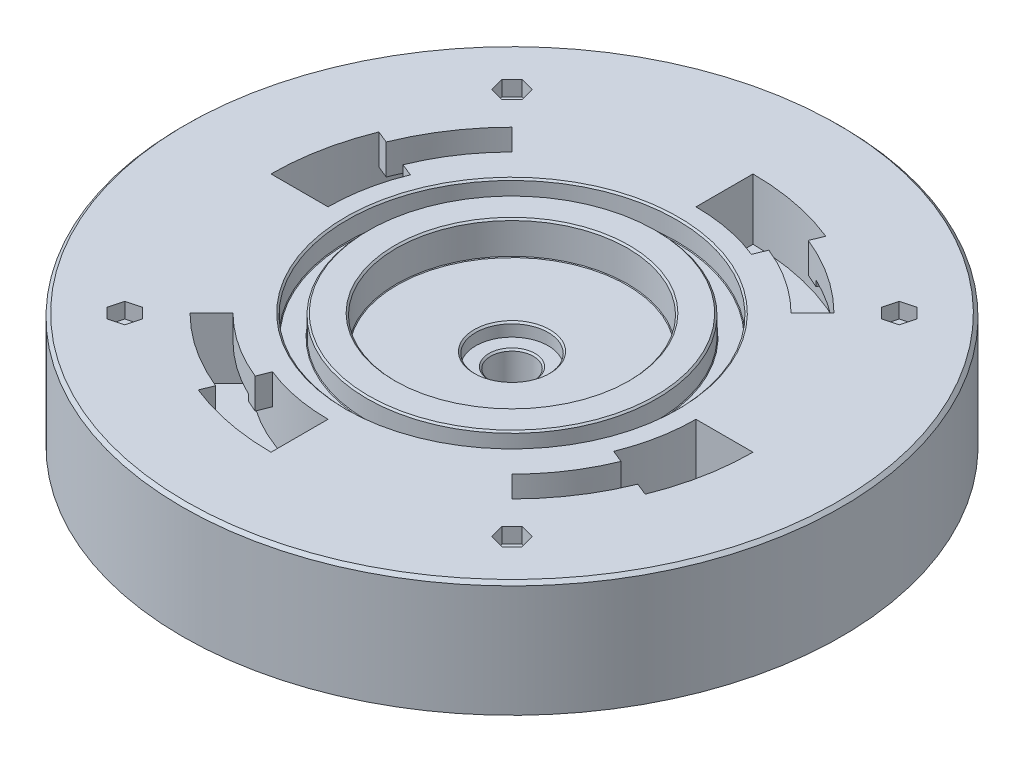
from build123d import *

# Parameters (mm, degrees)
SKETCH2_R                 = 50
BOSS_EXTRUDE1_DEPTH       = 10
SKETCH8_R                 = 17.55
CUT_EXTRUDE4_DEPTH        = 5.05
SKETCH12_R                = 3.25
CUT_EXTRUDE7_DEPTH        = 71.890778667
SKETCH13_R                = 5.5
CUT_EXTRUDE8_DEPTH        = 2
SKETCH14_R                = 15
SKETCH14_R_2              = 3.25
BOSS_EXTRUDE3_DEPTH       = 7.5
CHAMFER1_SIZE             = 7.5
SKETCH15_R                = 5.1
CUT_EXTRUDE9_DEPTH        = 2.5
CHAFL_N2_SIZE             = 0.5
SKETCH16_R                = 25
SKETCH16_R_2              = 22
CUT_EXTRUDE10_DEPTH       = 3.2
CHAMFER2_SIZE             = 0.1
CHAMFER3_SIZE             = 0.25
CHAMFER5_SIZE             = 0.25
SCALE1_SCALE              = 2.1714285
BOSS_EXTRUDE4_START       = -17.3714281
BOSS_EXTRUDE4_OUTLINE_R   = 108.571425
BOSS_EXTRUDE4_OUTLINE_R_2 = 57.926200599
BOSS_EXTRUDE4_DEPTH       = 17.3714281
BOSS_EXTRUDE5_START       = -5
SKETCH17_3_R              = 100.830783289
SKETCH17_3_R_2            = 57.926200599
BOSS_EXTRUDE5_DEPTH       = 5
CUT_EXTRUDE11_DEPTH       = 5.05
CIRPATTERN1_COUNT         = 4
CUT_EXTRUDE12_START       = -13
CUT_EXTRUDE12_DEPTH       = 29
BOSS_EXTRUDE6_START       = -8
BOSS_EXTRUDE6_DEPTH       = 8
CUT_EXTRUDE13_DEPTH       = 20
BOSS_EXTRUDE7_START       = 2
BOSS_EXTRUDE7_DEPTH       = 2
CIRPATTERN2_COUNT         = 4
CIRPATTERN3_COUNT         = 4


# Read off the part's stored shape, not the designer's step: Boss-Extrude4
with BuildPart() as part:
    # Sketch2 → Boss-Extrude1 (new body)
    with BuildSketch(Plane(origin=(0, 0, 0), x_dir=(1, 0, 0), z_dir=(0, 1, 0))):
        with Locations(Location((0, 0, 0), (0, 0, 270))):
            Circle(SKETCH2_R)
    extrude(amount=-BOSS_EXTRUDE1_DEPTH)

    # Sketch8 → Cut-Extrude4 (cut)
    with BuildSketch(Plane(origin=(0, 0, 0), x_dir=(1, 0, 0), z_dir=(0, 1, 0))):
        with Locations(Location((0, 0, 0), (0, 0, 270))):
            Circle(SKETCH8_R)
    extrude(amount=-CUT_EXTRUDE4_DEPTH, mode=Mode.SUBTRACT)

    # Sketch12 → Cut-Extrude7 (cut, through all)
    with BuildSketch(Plane(origin=(0, -5.05, 0), x_dir=(1, 0, 0), z_dir=(0, 1, 0))):
        with Locations(Location((0, 0, 0), (0, 0, 270))):
            Circle(SKETCH12_R)
    extrude(amount=-CUT_EXTRUDE7_DEPTH, mode=Mode.SUBTRACT)

    # Sketch13 → Cut-Extrude8 (cut)
    with BuildSketch(Plane(origin=(0, -5.05, 0), x_dir=(1, 0, 0), z_dir=(0, 1, 0))):
        with Locations(Location((0, 0, 0), (0, 0, 270))):
            Circle(SKETCH13_R)
    extrude(amount=-CUT_EXTRUDE8_DEPTH, mode=Mode.SUBTRACT)

    # Sketch14 → Boss-Extrude3 (add)
    with BuildSketch(Plane.XZ.offset(10)):
        with Locations(Location((0, 0, 0), (0, 0, 90))):
            Circle(SKETCH14_R)
        with Locations(Location((0, 0, 0), (0, 0, 90))):
            Circle(SKETCH14_R_2, mode=Mode.SUBTRACT)
    extrude(amount=BOSS_EXTRUDE3_DEPTH)

    # Chamfer1
    chamfer1_edges = [part.edges().sort_by_distance(p)[0] for p in [
        (0, -10, -15),
    ]]
    chamfer(chamfer1_edges, length=CHAMFER1_SIZE - 0.0001)  # a hair under: the kernel refuses the full size

    # Sketch15 → Cut-Extrude9 (cut)
    with BuildSketch(Plane.XZ.offset(17.5)):
        with Locations(Location((0, 0, 0), (0, 0, 270))):
            Circle(SKETCH15_R)
    extrude(amount=-CUT_EXTRUDE9_DEPTH, mode=Mode.SUBTRACT)

    # Chaflán2
    chafl_n2_edges = [part.edges().sort_by_distance(p)[0] for p in [
        (0, 0, -50),
        (0, -10, -50),
    ]]
    chamfer(chafl_n2_edges, length=CHAFL_N2_SIZE)

    # Sketch16 → Cut-Extrude10 (cut)
    with BuildSketch(Plane(origin=(0, 0, 0), x_dir=(1, 0, 0), z_dir=(0, 1, 0))):
        with Locations(Location((0, 0, 0), (0, 0, 270))):
            Circle(SKETCH16_R)
        with Locations(Location((0, 0, 0), (0, 0, 270))):
            Circle(SKETCH16_R_2, mode=Mode.SUBTRACT)
    extrude(amount=-CUT_EXTRUDE10_DEPTH, mode=Mode.SUBTRACT)

    # Chamfer2
    chamfer2_edges = [part.edges().sort_by_distance(p)[0] for p in [
        (0, -3.2, -25),
        (0, -3.2, -22),
        (0, -5.05, -17.55),
    ]]
    chamfer(chamfer2_edges, length=CHAMFER2_SIZE)

    # Chamfer3
    chamfer3_edges = [part.edges().sort_by_distance(p)[0] for p in [
        (0, -5.05, -5.5),
        (0, -7.05, -3.25),
        (0, 0, -25),
        (0, 0, -22),
        (0, 0, -17.55),
    ]]
    chamfer(chamfer3_edges, length=CHAMFER3_SIZE)

    # Chamfer5
    chamfer5_edges = [part.edges().sort_by_distance(p)[0] for p in [
        (0, -17.5, 5.1),
        (0, -15, -3.25),
    ]]
    chamfer(chamfer5_edges, length=CHAMFER5_SIZE)


with BuildPart() as part_1:
    # Scale1: scaled about (0, -6.02867632, 0)
    add(part.part.scale(SCALE1_SCALE).moved(Location((0, 7.062163259, 0))))

    # Boss-Extrude4 outline → Boss-Extrude4 (add)
    with BuildSketch(Plane.XZ.offset(30.93782581).offset(BOSS_EXTRUDE4_START)):
        Circle(BOSS_EXTRUDE4_OUTLINE_R)
        Circle(BOSS_EXTRUDE4_OUTLINE_R_2, mode=Mode.SUBTRACT)
    extrude(amount=BOSS_EXTRUDE4_DEPTH)

    # Sketch17<3> → Boss-Extrude5 (add)
    with BuildSketch(Plane.XZ.offset(30.93782581).offset(BOSS_EXTRUDE5_START)):
        Circle(SKETCH17_3_R)
        with Locations(Location((0, 0, 0), (0, 0, 270))):
            Circle(SKETCH17_3_R_2, mode=Mode.SUBTRACT)
    extrude(amount=BOSS_EXTRUDE5_DEPTH)

    # Sketch18 → Cut-Extrude11 (cut)
    with BuildSketch(Plane(origin=(0, 7.06217294, 0), x_dir=(1, 0, 0), z_dir=(0, 1, 0))):
        Polygon((-65.009306884, 68.356942866), (-68.356942866, 65.009306884), (-67.131623054, 60.43635109), (-62.55866726, 59.211031278), (-59.211031278, 62.55866726), (-60.43635109, 67.131623054), align=None)
    cut_extrude11 = extrude(amount=-CUT_EXTRUDE11_DEPTH, mode=Mode.SUBTRACT)

    # CirPattern1: Cut-Extrude11 ×4 about axis
    cirpattern1_axis = Axis((0, 0, 0), (0, 1, 0))
    for i in range(1, CIRPATTERN1_COUNT):
        add(cut_extrude11.rotate(cirpattern1_axis, i * 360 / CIRPATTERN1_COUNT), mode=Mode.SUBTRACT)

    # Sketch19 → Cut-Extrude12 (cut)
    with BuildSketch(Plane(origin=(0, 0, 0), x_dir=(1, 0, 0), z_dir=(0, 1, 0)).offset(CUT_EXTRUDE12_START)):
        with BuildLine():
            Line((-79.4, 0), (-60.6, 0))
            ThreePointArc((-60.6, 0), (-55.98709967, 23.190616001), (-42.85067094, 42.85067094))
            Line((-42.85067094, 42.85067094), (-43.15860775, 43.15860775))
            Line((-43.15860775, 43.15860775), (-56.144278426, 56.144278426))
            ThreePointArc((-56.144278426, 56.144278426), (-73.356034881, 30.38506453), (-79.4, 0))
        make_face()
    cut_extrude12 = extrude(amount=CUT_EXTRUDE12_DEPTH, mode=Mode.SUBTRACT)

    # Sketch20 → Boss-Extrude6 (add)
    with BuildSketch(Plane(origin=(0, 7.06217294, 0), x_dir=(1, 0, 0), z_dir=(0, 1, 0)).offset(BOSS_EXTRUDE6_START)):
        with BuildLine():
            Line((-56.187341587, 22.701159561), (-73.618398053, 29.743763517))
            ThreePointArc((-73.618398053, 29.743763517), (-66.210534272, 43.823796634), (-56.144278426, 56.144278426))
            Line((-56.144278426, 56.144278426), (-42.85067094, 42.85067094))
            ThreePointArc((-42.85067094, 42.85067094), (-50.533480817, 33.44738131), (-56.187341587, 22.701159561))
        make_face()
    boss_extrude6 = extrude(amount=BOSS_EXTRUDE6_DEPTH)

    # Sketch21 → Cut-Extrude13 (cut)
    with BuildSketch(Plane(origin=(0, 7.06217294, 0), x_dir=(1, 0, 0), z_dir=(0, 1, 0))):
        with BuildLine():
            Line((-45.961940777, 45.961940777), (-53.033008589, 53.033008589))
            ThreePointArc((-53.033008589, 53.033008589), (-62.541436655, 41.395273898), (-69.538789093, 28.095494506))
            Line((-69.538789093, 28.095494506), (-60.266950547, 24.349428572))
            ThreePointArc((-60.266950547, 24.349428572), (-54.202578434, 35.875904045), (-45.961940777, 45.961940777))
        make_face()
    cut_extrude13 = extrude(amount=-CUT_EXTRUDE13_DEPTH, mode=Mode.SUBTRACT)

    # Sketch22 → Boss-Extrude7 (add)
    with BuildSketch(Plane.XZ.offset(0.93782706).offset(BOSS_EXTRUDE7_START)):
        with BuildLine():
            Line((-58.561646908, -28.205203623), (-54.597473887, -26.295928301))
            ThreePointArc((-54.597473887, -26.295928301), (-55.421561016, -24.511437627), (-56.187341587, -22.701159561))
            Line((-56.187341587, -22.701159561), (-60.266950547, -24.349428572))
            ThreePointArc((-60.266950547, -24.349428572), (-59.445568746, -26.29114597), (-58.561646908, -28.205203623))
        make_face()
        with BuildLine():
            ThreePointArc((-67.571131048, -32.544465719), (-68.591040861, -30.335937658), (-69.538789093, -28.095494506))
            Line((-69.538789093, -28.095494506), (-73.618398053, -29.743763517))
            ThreePointArc((-73.618398053, -29.743763517), (-72.615048592, -32.115646), (-71.535304069, -34.453741041))
            Line((-71.535304069, -34.453741041), (-67.571131048, -32.544465719))
        make_face()
    boss_extrude7 = extrude(amount=-BOSS_EXTRUDE7_DEPTH)

    # CirPattern2: Cut-Extrude12, Boss-Extrude6, Cut-Extrude13 ×4 about axis
    cirpattern2_axis = Axis((0, 6.519315815, 0), (0, 1, 0))
    add([cut_extrude12.rotate(cirpattern2_axis, i * 360 / CIRPATTERN2_COUNT) for i in range(1, CIRPATTERN2_COUNT)], mode=Mode.SUBTRACT)
    add([boss_extrude6.rotate(cirpattern2_axis, i * 360 / CIRPATTERN2_COUNT) for i in range(1, CIRPATTERN2_COUNT)])
    add([cut_extrude13.rotate(cirpattern2_axis, i * 360 / CIRPATTERN2_COUNT) for i in range(1, CIRPATTERN2_COUNT)], mode=Mode.SUBTRACT)

    # CirPattern3: Boss-Extrude7 ×4 about axis
    cirpattern3_axis = Axis((0, -8.246397985, 0), (0, 1, 0))
    for i in range(1, CIRPATTERN3_COUNT):
        add(boss_extrude7.rotate(cirpattern3_axis, i * 360 / CIRPATTERN3_COUNT))


solid = part_1.part
